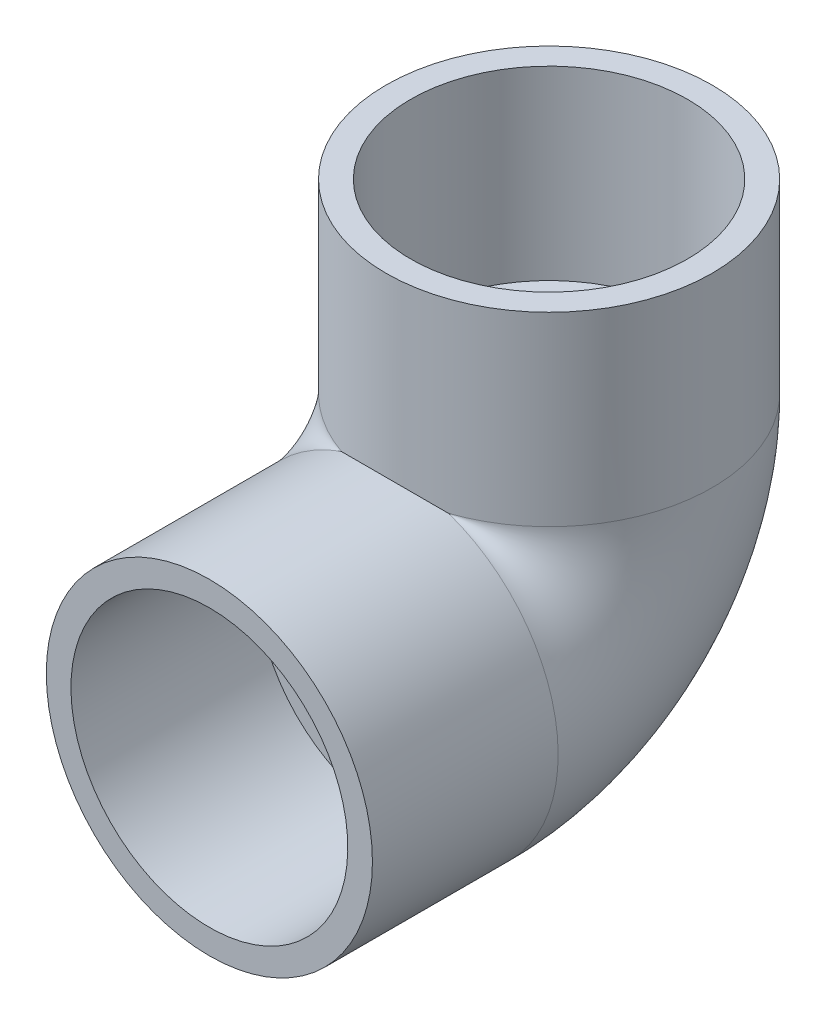
from build123d import *

# Parameters (mm, degrees)
SKETCH2_W        = 32.54375
SKETCH2_H        = 4.318
SKETCH3_W        = 4.318
SKETCH3_H        = 32.54375
SWEEP1_OUTLINE_R = 20.2184
SWEEP1_ANGLE     = 90


# Read off the part's stored shape, not the designer's step: Sweep1
with BuildPart() as part:
    # Sketch2 → Revolve1 (revolve)
    with BuildSketch(Plane(origin=(0, 0, 0), x_dir=(0, 0, -1), z_dir=(1, 0, 0))):
        with Locations((-43.259375, 26.416)):
            Rectangle(SKETCH2_W, SKETCH2_H)
    revolve(axis=Axis((0, 0, 0), (0, 0, 1)))

    # Sketch3 → Revolve2 (revolve)
    with BuildSketch(Plane(origin=(0, 0, 0), x_dir=(0, 0, -1), z_dir=(1, 0, 0))):
        with Locations((26.416, 43.259375)):
            Rectangle(SKETCH3_W, SKETCH3_H)
    revolve(axis=Axis((0, 0, 0), (0, 1, 0)))

    # Sweep1 outline → Sweep1 (revolve)
    with BuildSketch(Plane(origin=(0, 26.9875, 26.9875), x_dir=(0, -1, 0), z_dir=(0, 0, 1))):
        with BuildLine():
            Line((0, 9.391776656), (0, -9.391776656))
            add(Edge.make_bspline(
                [(0, -9.391776656), (1.964798733, -15.037673887), (5.707302137, -21.000466213), (11.762880351, -26.190133214), (19.651805228, -28.575000029), (30.941744751, -28.574999985), (34.794268384, -27.890853023), (38.302007965, -26.594990769), (41.349039173, -24.913061828), (47.645719773, -20.2714193), (51.182741194, -16.512913116), (54.099490529, -11.584072733), (57.016528368, 6.1e-08), (54.099490474, 11.584072826), (51.182741149, 16.512913163), (47.64571975, 20.271419317), (41.349039135, 24.913061856), (38.302007875, 26.594990818), (34.794268228, 27.89085308), (30.941744524, 28.575000025), (19.651804984, 28.574999954), (11.762880203, 26.19013309), (5.707302076, 21.000466114), (1.964798718, 15.037673842), (0, 9.391776656)],
                knots=[3.476488812, 3.476488812, 3.476488812, 3.476488812, 3.476488812, 3.476488812, 4.692265571, 4.692265571, 4.692265571, 4.692265571, 5.347619809, 5.347619809, 5.347619809, 5.347619809, 6.28318531, 6.28318531, 6.28318531, 7.218750806, 7.218750806, 7.218750806, 7.218750806, 7.874105053, 7.874105053, 7.874105053, 7.874105053, 9.089881802, 9.089881802, 9.089881802, 9.089881802, 9.089881802, 9.089881802], degree=5, weights=[1, 1, 0.992691938, 0.987056826, 1, 1, 0.999773106, 1.000181303, 1, 1, 0.99903111, 0.996921147, 1.003078853, 0.996921147, 0.99903111, 1, 1, 1.000181303, 0.999773106, 1, 1, 0.987056827, 0.992691939, 1, 1]))
        make_face()
        with Locations((26.9875, 0)):
            Circle(SWEEP1_OUTLINE_R, mode=Mode.SUBTRACT)
    revolve(axis=Axis((0, 26.9875, 26.9875), (1, 0, 0)), revolution_arc=SWEEP1_ANGLE)


solid = part.part
